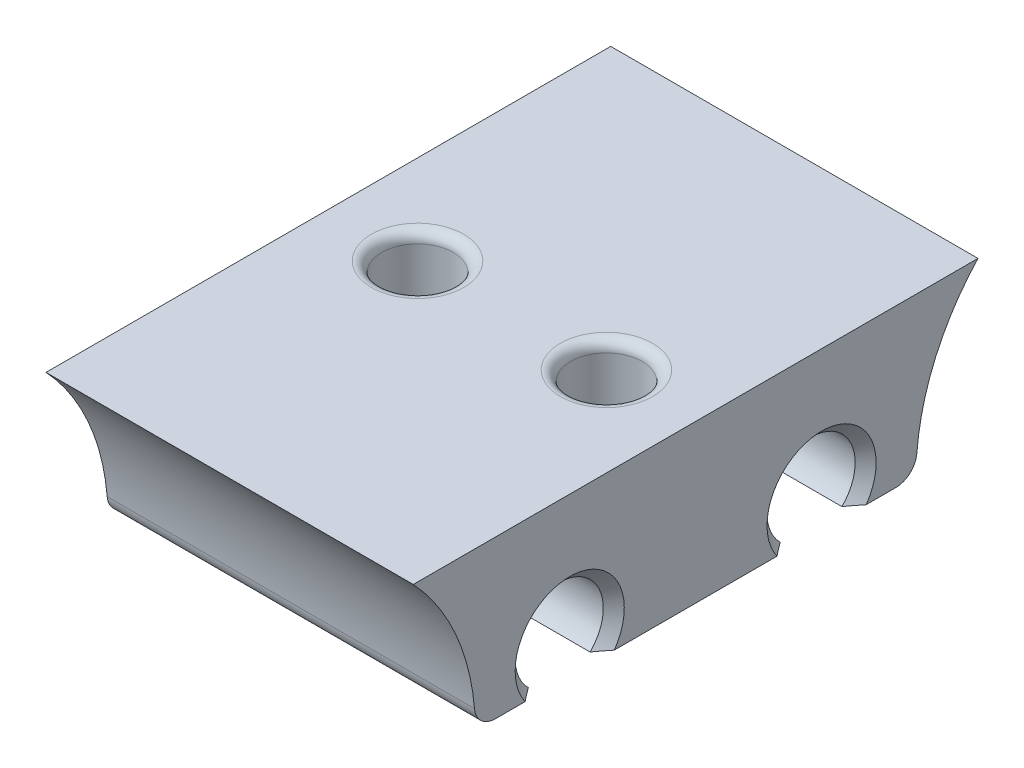
from build123d import *

# Parameters (mm, degrees)
SKETCH1_W                                           = 17.5
SKETCH1_H                                           = 8.5
BOSS_EXTRUDE1_DEPTH                                 = 10.5
CUT_EXTRUDE1_DEPTH                                  = 21.846162716
CUT_EXTRUDE1_DEPTH_BACK                             = 21.846162716
SKETCH2_R                                           = 2.1
CHAMFER1_SIZE                                       = 0.5
CSK_FOR_M3_COUNTERSUNK_FLAT_HEAD_SCREW1_D           = 3.4
CSK_FOR_M3_COUNTERSUNK_FLAT_HEAD_SCREW1_DEPTH       = 19
CSK_FOR_M3_COUNTERSUNK_FLAT_HEAD_SCREW1_CSINK_D     = 6.3
CSK_FOR_M3_COUNTERSUNK_FLAT_HEAD_SCREW1_CSINK_ANGLE = 90
CSK_FOR_M3_COUNTERSUNK_FLAT_HEAD_SCREW1_TIP         = 1.021463052
FILLET1_R                                           = 0.5
CUT_EXTRUDE2_DEPTH                                  = 21.846162716
CUT_EXTRUDE2_DEPTH_BACK                             = 21.846162716
SKETCH6_W                                           = 21
SKETCH6_H                                           = 1
BOSS_EXTRUDE2_DEPTH                                 = 17.5
FILLET2_R                                           = 1


with BuildPart() as part:
    # Sketch1 → Boss-Extrude1 (new, symmetric)
    with BuildSketch(Plane.XY):
        Rectangle(SKETCH1_W, SKETCH1_H)
    extrude(amount=BOSS_EXTRUDE1_DEPTH, both=True)

    # Sketch2 → Cut-Extrude1 (cut, two sides: drawn at the far end of the back side and taken through both)
    with BuildSketch(Plane.ZY.offset(8.75).offset(-CUT_EXTRUDE1_DEPTH_BACK)):
        with Locations((6, -1.75)):
            Circle(SKETCH2_R)
        with Locations(Location((-6, -1.75, 0), (0, 0, 180))):
            Circle(SKETCH2_R)
        with BuildLine():
            Line((3.401923789, -3.25), (-3.401923789, -3.25))
            ThreePointArc((-3.401923789, -3.25), (-3.813859338, -3.804455891), (-4.341687605, -4.25))
            Line((-4.341687605, -4.25), (4.341687605, -4.25))
            ThreePointArc((4.341687605, -4.25), (3.813859338, -3.804455891), (3.401923789, -3.25))
        make_face()
    extrude(amount=CUT_EXTRUDE1_DEPTH + CUT_EXTRUDE1_DEPTH_BACK, mode=Mode.SUBTRACT)

    # Chamfer1
    # the kernel refuses this chamfer: 0.5 mm, written as the material it takes off along each edge
    with BuildSketch(Plane(origin=(8.75, -1.75, -6), x_dir=(0, 0, -1), z_dir=(0, 1, 0))) as chamfer1_piece_1:
        Polygon((2.1 + CHAMFER1_SIZE, 0), (2.1, CHAMFER1_SIZE), (2.1, 0), align=None)
    revolve(axis=Axis((8.75, -1.75, -6), (-1, 0, 0)), mode=Mode.SUBTRACT)
    with BuildSketch(Plane(origin=(-8.75, -1.75, -6), x_dir=(0, 0, -1), z_dir=(0, 1, 0))) as chamfer1_piece_2:
        Polygon((2.1 + CHAMFER1_SIZE, 0), (2.1, -CHAMFER1_SIZE), (2.1, 0), align=None)
    revolve(axis=Axis((-8.75, -1.75, -6), (-1, 0, 0)), mode=Mode.SUBTRACT)
    with BuildSketch(Plane(origin=(8.75, -1.75, 6), x_dir=(0, 0, 1), z_dir=(0, -1, 0))) as chamfer1_piece_3:
        Polygon((2.1 + CHAMFER1_SIZE, 0), (2.1, CHAMFER1_SIZE), (2.1, 0), align=None)
    revolve(axis=Axis((8.75, -1.75, 6), (-1, 0, 0)), mode=Mode.SUBTRACT)
    with BuildSketch(Plane(origin=(-8.75, -1.75, 6), x_dir=(0, 0, 1), z_dir=(0, -1, 0))) as chamfer1_piece_4:
        Polygon((2.1 + CHAMFER1_SIZE, 0), (2.1, -CHAMFER1_SIZE), (2.1, 0), align=None)
    revolve(axis=Axis((-8.75, -1.75, 6), (-1, 0, 0)), mode=Mode.SUBTRACT)

    # CSK for M3 Countersunk Flat Head Screw1
    with Locations(Plane(origin=(0, -3.25, 0), x_dir=(-1, 0, 0), z_dir=(0, -1, 0))):
        with Locations((4.5, 0), (-4.5, 0)):
            CounterSinkHole(CSK_FOR_M3_COUNTERSUNK_FLAT_HEAD_SCREW1_D / 2, CSK_FOR_M3_COUNTERSUNK_FLAT_HEAD_SCREW1_CSINK_D / 2, depth=CSK_FOR_M3_COUNTERSUNK_FLAT_HEAD_SCREW1_DEPTH, counter_sink_angle=CSK_FOR_M3_COUNTERSUNK_FLAT_HEAD_SCREW1_CSINK_ANGLE)
            with Locations((0, 0, -(CSK_FOR_M3_COUNTERSUNK_FLAT_HEAD_SCREW1_DEPTH + CSK_FOR_M3_COUNTERSUNK_FLAT_HEAD_SCREW1_TIP / 2))):  # 118° drill point
                Cone(0, CSK_FOR_M3_COUNTERSUNK_FLAT_HEAD_SCREW1_D / 2, CSK_FOR_M3_COUNTERSUNK_FLAT_HEAD_SCREW1_TIP, mode=Mode.SUBTRACT)

    # Fillet1
    fillet1_edges = [part.edges().sort_by_distance(p)[0] for p in [
        (2.8, 4.25, 0),
        (-6.2, 4.25, 0),
    ]]
    fillet(fillet1_edges, radius=FILLET1_R)

    # Sketch6 → Cut-Extrude2 (cut, two sides: drawn at the far end of the back side and taken through both)
    with BuildSketch(Plane.ZY.offset(8.75).offset(-CUT_EXTRUDE2_DEPTH_BACK)):
        with Locations((0, -3.75)):
            Rectangle(SKETCH6_W, SKETCH6_H)
    extrude(amount=CUT_EXTRUDE2_DEPTH + CUT_EXTRUDE2_DEPTH_BACK, mode=Mode.SUBTRACT)

    # Sketch8 → Boss-Extrude2 (add)
    with BuildSketch(Plane.ZY.offset(8.75)):
        with BuildLine():
            Line((-13.45326153, 4.25), (-10.5, 4.25))
            Line((-10.5, 4.25), (-10.5, -3.25))
            ThreePointArc((-10.5, -3.25), (-11.26491028, 0.780252897), (-13.45326153, 4.25))
        make_face()
        with BuildLine():
            Line((13.45326153, 4.25), (10.5, 4.25))
            Line((10.5, 4.25), (10.5, -3.25))
            ThreePointArc((10.5, -3.25), (11.26491028, 0.780252897), (13.45326153, 4.25))
        make_face()
    extrude(amount=-BOSS_EXTRUDE2_DEPTH)

    # Fillet2
    fillet2_edges = [part.edges().sort_by_distance(p)[0] for p in [
        (0, -3.25, 10.5),
        (0, -3.25, -10.5),
    ]]
    fillet(fillet2_edges, radius=FILLET2_R)


solid = part.part
